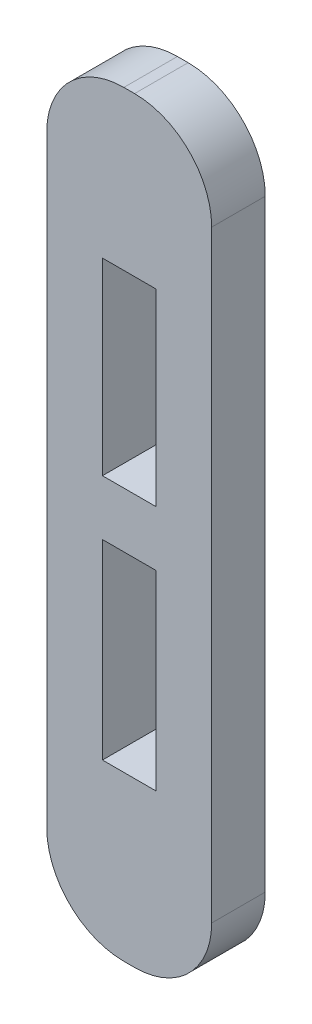
from build123d import *

# Parameters (mm, degrees)
SKETCH1_W           = 4.8895
SKETCH1_H           = 22.437212452
BOSS_EXTRUDE1_DEPTH = 1.5875
CUT_EXTRUDE1_DEPTH  = 24.01859833
FILLET1_R           = 2.286


with BuildPart() as part:
    # Sketch1 → Boss-Extrude1 (new body)
    with BuildSketch(Plane.XY):
        with Locations((2.44475, 11.218606226)):
            Rectangle(SKETCH1_W, SKETCH1_H)
    extrude(amount=BOSS_EXTRUDE1_DEPTH)

    # Sketch2 → Cut-Extrude1 (cut, through all)
    with BuildSketch(Plane(origin=(0, 0, 0), x_dir=(-1, 0, 0), z_dir=(0, 0, -1))):
        Polygon((-3.2385, 15.198209681), (-3.2385, 12.150209681), (-1.651, 12.150209681), (-1.651, 15.198209681), (-1.651, 16.468209681), (-1.651, 17.738209681), (-3.2385, 17.738209681), (-3.2385, 16.468209681), align=None)
        Polygon((-1.651, 6.044867793), (-1.651, 7.312462453), (-1.651, 10.512192497), (-3.2385, 10.512192497), (-3.2385, 7.312462453), (-3.2385, 6.044867793), (-3.2385, 4.850732815), (-1.651, 4.850732815), align=None)
    extrude(amount=-CUT_EXTRUDE1_DEPTH, mode=Mode.SUBTRACT)

    # Fillet1
    fillet1_edges = [part.edges().sort_by_distance(p)[0] for p in [
        (0, 0, 0.79375),
        (4.8895, 0, 0.79375),
        (4.8895, 22.437212452, 0.79375),
        (0, 22.437212452, 0.79375),
    ]]
    fillet(fillet1_edges, radius=FILLET1_R)


solid = part.part
